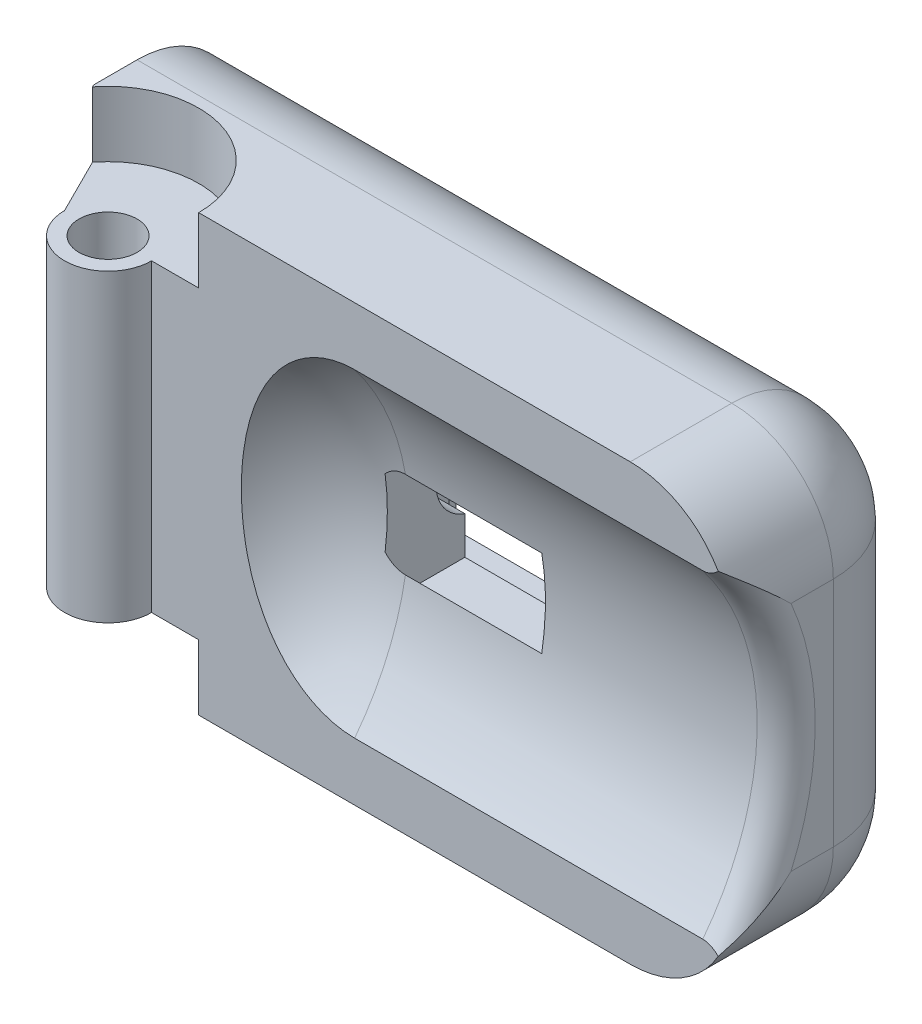
from build123d import *

# Parameters (mm, degrees)
CROQUIS1_W                 = 48
CROQUIS1_H                 = 30
SALIENTE_EXTRUIR1_DEPTH    = 14
CORTAR_EXTRUIR1_DEPTH      = 36
REDONDEO1_R                = 2
REDONDEO2_R                = 7
CROQUIS3_W                 = 21.5
CROQUIS3_H                 = 18
CORTAR_EXTRUIR2_DEPTH      = 3
CORTAR_EXTRUIR3_REACH      = 50.842
CORTAR_EXTRUIR3_END_RADIUS = 18
CROQUIS5_R                 = 1
CROQUIS6_W                 = 10.8
CROQUIS6_H                 = 10.8
CORTAR_EXTRUIR4_DEPTH      = 7.5
CROQUIS7_W                 = 17
CROQUIS7_H                 = 16
CORTAR_EXTRUIR5_DEPTH      = 2
CROQUIS9_R                 = 3
SALIENTE_EXTRUIR2_DEPTH    = 30
CROQUIS10_R                = 6.25
CORTAR_EXTRUIR7_DEPTH      = 4.5
CROQUIS11_R                = 2
CORTAR_EXTRUIR8_DEPTH      = 21
CORTAR_EXTRUIR9_REACH      = 57.883
CROQUIS13_W                = 3
CROQUIS13_H                = 5
CORTAR_EXTRUIR10_DEPTH     = 3
REDONDEO3_R                = 10
CROQUIS14_R                = 2.948637221
CORTAR_EXTRUIR15_DEPTH     = 21


with BuildPart() as part:
    # Croquis1 → Saliente-Extruir1 (new body)
    with BuildSketch(Plane.XY):
        with Locations((-19.976765257, 0.987352556)):
            Rectangle(CROQUIS1_W, CROQUIS1_H)
    extrude(amount=SALIENTE_EXTRUIR1_DEPTH)

    # Croquis2 → Cortar-Extruir1 (cut)
    with BuildSketch(Plane(origin=(4.023234743, 0, 0), x_dir=(0, 0, -1), z_dir=(1, 0, 0))):
        with BuildLine():
            ThreePointArc((-14, -10.012647444), (-10.247806849, 0.987352556), (-14, 11.987352556))
            Line((-14, 11.987352556), (-14, -10.012647444))
        make_face()
    extrude(amount=-CORTAR_EXTRUIR1_DEPTH, mode=Mode.SUBTRACT)

    # Redondeo1
    redondeo1_edges = [part.edges().sort_by_distance(p)[0] for p in [
        (4.023234743, 0.987352556, 10.247806849),
    ]]
    fillet(redondeo1_edges, radius=REDONDEO1_R)

    # Redondeo2
    # the kernel refuses this fillet: 7 mm, written as the material it takes off along each edge
    with BuildSketch(Plane(origin=(-2.976765257, -7.012647444, 7), x_dir=(0, -1, 0), z_dir=(1, 0, 0))) as redondeo2_piece_1_section:
        Polygon((0, 0), (REDONDEO2_R * 1.02, 0), (REDONDEO2_R * 1.02, REDONDEO2_R * 1.02), (0, REDONDEO2_R * 1.02), align=None)
    redondeo2_piece_1 = extrude(amount=REDONDEO2_R * 1.02, mode=Mode.PRIVATE)
    redondeo2_piece_1 = redondeo2_piece_1 - Plane(origin=(-2.976765257, -7.012647444, 7), x_dir=(0, 0.7071067811865475, 0.7071067811865475), z_dir=(1, 0, 0)) * Sphere(REDONDEO2_R, mode=Mode.PRIVATE)
    add(redondeo2_piece_1, mode=Mode.SUBTRACT)
    with BuildSketch(Plane(origin=(-2.976765257, 8.987352556, 7), x_dir=(0, 0, -1), z_dir=(1, 0, 0))) as redondeo2_piece_2_section:
        Polygon((0, 0), (REDONDEO2_R * 1.02, 0), (REDONDEO2_R * 1.02, REDONDEO2_R * 1.02), (0, REDONDEO2_R * 1.02), align=None)
    redondeo2_piece_2 = extrude(amount=REDONDEO2_R * 1.02, mode=Mode.PRIVATE)
    redondeo2_piece_2 = redondeo2_piece_2 - Plane(origin=(-2.976765257, 8.987352556, 7), x_dir=(0, -0.7071067811865475, 0.7071067811865475), z_dir=(1, 0, 0)) * Sphere(REDONDEO2_R, mode=Mode.PRIVATE)
    add(redondeo2_piece_2, mode=Mode.SUBTRACT)
    with BuildSketch(Plane(origin=(-2.976765257, -14.012647444, 0), x_dir=(0, 0, 1), z_dir=(-1, 0, 0))) as redondeo2_piece_3:
        with BuildLine():
            CenterArc((REDONDEO2_R, REDONDEO2_R), REDONDEO2_R, 180, 90)
            Line((0, REDONDEO2_R), (-REDONDEO2_R * 0.02, REDONDEO2_R))
            Line((-REDONDEO2_R * 0.02, REDONDEO2_R), (-REDONDEO2_R * 0.02, -REDONDEO2_R * 0.02))
            Line((-REDONDEO2_R * 0.02, -REDONDEO2_R * 0.02), (REDONDEO2_R, -REDONDEO2_R * 0.02))
            Line((REDONDEO2_R, -REDONDEO2_R * 0.02), (REDONDEO2_R, 0))
        make_face()
    extrude(amount=58.5, mode=Mode.SUBTRACT)
    with BuildSketch(Plane(origin=(4.023234743, 8.987352556, 0), x_dir=(0, 0, 1), z_dir=(0, -1, 0))) as redondeo2_piece_4:
        with BuildLine():
            CenterArc((REDONDEO2_R, REDONDEO2_R), REDONDEO2_R, 180, 90)
            Line((0, REDONDEO2_R), (-REDONDEO2_R * 0.02, REDONDEO2_R))
            Line((-REDONDEO2_R * 0.02, REDONDEO2_R), (-REDONDEO2_R * 0.02, -REDONDEO2_R * 0.02))
            Line((-REDONDEO2_R * 0.02, -REDONDEO2_R * 0.02), (REDONDEO2_R, -REDONDEO2_R * 0.02))
            Line((REDONDEO2_R, -REDONDEO2_R * 0.02), (REDONDEO2_R, 0))
        make_face()
    extrude(amount=16, mode=Mode.SUBTRACT)
    with BuildSketch(Plane(origin=(-61.476765257, 15.987352556, 0), x_dir=(0, -1, 0), z_dir=(1, 0, 0))) as redondeo2_piece_5:
        with BuildLine():
            CenterArc((REDONDEO2_R, -REDONDEO2_R), REDONDEO2_R, 90, 90)
            Line((0, -REDONDEO2_R), (-REDONDEO2_R * 0.02, -REDONDEO2_R))
            Line((-REDONDEO2_R * 0.02, -REDONDEO2_R), (-REDONDEO2_R * 0.02, REDONDEO2_R * 0.02))
            Line((-REDONDEO2_R * 0.02, REDONDEO2_R * 0.02), (REDONDEO2_R, REDONDEO2_R * 0.02))
            Line((REDONDEO2_R, REDONDEO2_R * 0.02), (REDONDEO2_R, 0))
        make_face()
    extrude(amount=58.5, mode=Mode.SUBTRACT)
    with BuildSketch(Plane(origin=(4.023234743, 15.987352556, 7), x_dir=(0, -1, 0), z_dir=(0, 0, 1))) as redondeo2_piece_6:
        with BuildLine():
            CenterArc((REDONDEO2_R, -REDONDEO2_R), REDONDEO2_R, 90, 90)
            Line((0, -REDONDEO2_R), (-REDONDEO2_R * 0.02, -REDONDEO2_R))
            Line((-REDONDEO2_R * 0.02, -REDONDEO2_R), (-REDONDEO2_R * 0.02, REDONDEO2_R * 0.02))
            Line((-REDONDEO2_R * 0.02, REDONDEO2_R * 0.02), (REDONDEO2_R, REDONDEO2_R * 0.02))
            Line((REDONDEO2_R, REDONDEO2_R * 0.02), (REDONDEO2_R, 0))
        make_face()
    extrude(amount=24.5, mode=Mode.SUBTRACT)
    with BuildSketch(Plane(origin=(4.023234743, -14.012647444, 7), x_dir=(0, 1, 0), z_dir=(0, 0, 1))) as redondeo2_piece_7:
        with BuildLine():
            CenterArc((REDONDEO2_R, REDONDEO2_R), REDONDEO2_R, 180, 90)
            Line((0, REDONDEO2_R), (-REDONDEO2_R * 0.02, REDONDEO2_R))
            Line((-REDONDEO2_R * 0.02, REDONDEO2_R), (-REDONDEO2_R * 0.02, -REDONDEO2_R * 0.02))
            Line((-REDONDEO2_R * 0.02, -REDONDEO2_R * 0.02), (REDONDEO2_R, -REDONDEO2_R * 0.02))
            Line((REDONDEO2_R, -REDONDEO2_R * 0.02), (REDONDEO2_R, 0))
        make_face()
    extrude(amount=24.5, mode=Mode.SUBTRACT)

    # Croquis3 → Cortar-Extruir2 (cut)
    with BuildSketch(Plane(origin=(0, 0, 0), x_dir=(-1, 0, 0), z_dir=(0, 0, -1))):
        with Locations((18.226765257, 0.987352556)):
            Rectangle(CROQUIS3_W, CROQUIS3_H)
    extrude(amount=-CORTAR_EXTRUIR2_DEPTH, mode=Mode.SUBTRACT)

    # Cortar-Extruir3: up to this cylinder (the profile starts outside it)
    cortar_extruir3_end = Plane(origin=(-17.976765, 0.987352556, 28.247806849), z_dir=(1, 0, 0)) * Cylinder(CORTAR_EXTRUIR3_END_RADIUS, 138.684, mode=Mode.PRIVATE)
    # Croquis5 → Cortar-Extruir3 (cut, up to the surface)
    with BuildSketch(Plane(origin=(0, 0, 0), x_dir=(-1, 0, 0), z_dir=(0, 0, -1)), mode=Mode.PRIVATE) as cortar_extruir3_sk1:
        with Locations((17.976765257, 0.987352556)):
            Circle(CROQUIS5_R)
    cortar_extruir3_tool1 = extrude(cortar_extruir3_sk1.sketch, amount=-CORTAR_EXTRUIR3_REACH, mode=Mode.PRIVATE) - cortar_extruir3_end
    add(cortar_extruir3_tool1.solids().sort_by_distance((-17.976765, 0.987353, 0))[0], mode=Mode.SUBTRACT)

    # Croquis6 → Cortar-Extruir4 (cut)
    with BuildSketch(Plane(origin=(0, 0, 3), x_dir=(-1, 0, 0), z_dir=(0, 0, -1))):
        with Locations((17.976765257, 0.987352556)):
            Rectangle(CROQUIS6_W, CROQUIS6_H)
    extrude(amount=-CORTAR_EXTRUIR4_DEPTH, mode=Mode.SUBTRACT)

    # Croquis7 → Cortar-Extruir5 (cut)
    with BuildSketch(Plane(origin=(0, 0, 3), x_dir=(-1, 0, 0), z_dir=(0, 0, -1))):
        with Locations((17.976765257, 0.987352556)):
            Rectangle(CROQUIS7_W, CROQUIS7_H)
    extrude(amount=-CORTAR_EXTRUIR5_DEPTH, mode=Mode.SUBTRACT)

    # Croquis9 → Saliente-Extruir2 (add)
    with BuildSketch(Plane.XZ.offset(14.012647444)):
        with Locations((-38.976765257, 14)):
            Circle(CROQUIS9_R)
    extrude(amount=-SALIENTE_EXTRUIR2_DEPTH)

    # Croquis10 → Cortar-Extruir7 (cut)
    with BuildSketch(Plane(origin=(0, 15.987352556, 0), x_dir=(1, 0, 0), z_dir=(0, 1, 0))):
        with Locations((-38.976765257, -14)):
            Circle(CROQUIS10_R)
    cortar_extruir7 = extrude(amount=-CORTAR_EXTRUIR7_DEPTH, mode=Mode.SUBTRACT)

    # Simetría1: Cortar-Extruir7 across plane
    add(cortar_extruir7.mirror(Plane.ZX.offset(0.987352556)), mode=Mode.SUBTRACT)

    # Croquis11 → Cortar-Extruir8 (cut)
    with BuildSketch(Plane(origin=(0, 11.487352556, 0), x_dir=(-1, 0, 0), z_dir=(0, 1, 0))):
        with Locations(Location((38.976765257, 14, 0), (0, 0, 90))):
            Circle(CROQUIS11_R)
    extrude(amount=-CORTAR_EXTRUIR8_DEPTH, mode=Mode.SUBTRACT)

    # Cortar-Extruir9: up to this face of the body (flat: up to its plane)
    cortar_extruir9_end = Plane(part.part.faces().sort_by_distance((-19.613737998, -14.012647444, 10.301702011))[0])
    # Croquis12 → Cortar-Extruir9 (cut, up to the picked face)
    with BuildSketch(Plane(origin=(0, 15.987352556, 0), x_dir=(1, 0, 0), z_dir=(0, 1, 0)), mode=Mode.PRIVATE) as cortar_extruir9_sk1:
        Polygon((-43.976765257, -10), (-43.976765257, -14), (-41.976765257, -14), align=None)
    cortar_extruir9_tool1 = split(extrude(cortar_extruir9_sk1.sketch, amount=-CORTAR_EXTRUIR9_REACH, mode=Mode.PRIVATE), bisect_by=cortar_extruir9_end, keep=Keep.BOTH, mode=Mode.PRIVATE)
    add(cortar_extruir9_tool1.solids().sort_by(Axis((-43.310099, 15.987353, 12.666667), (0, -1, 0)))[0], mode=Mode.SUBTRACT)

    # Croquis13 → Cortar-Extruir10 (cut)
    with BuildSketch(Plane(origin=(0, 0, 0), x_dir=(-1, 0, 0), z_dir=(0, 0, -1))):
        with Locations((30.476765257, 0.987352556)):
            Rectangle(CROQUIS13_W, CROQUIS13_H)
    extrude(amount=-CORTAR_EXTRUIR10_DEPTH, mode=Mode.SUBTRACT)

    # Redondeo3
    # the kernel refuses this fillet: 10 mm, written as the material it adds along each edge
    with BuildSketch(Plane(origin=(-31.976765257, 0.987352556, 28.247806849), x_dir=(0, -0.8888591986408035, 0.45818045025036674), z_dir=(0, 0.45818045025036674, 0.8888591986408035))) as redondeo3_piece_1_section:
        with BuildLine():
            CenterArc((18 - REDONDEO3_R, REDONDEO3_R), REDONDEO3_R, 270, 90)
            Line((18 - REDONDEO3_R, 0), (18, 0))
            Line((18, 0), (18, REDONDEO3_R))
        make_face()
    redondeo3_piece_1 = revolve(axis=Axis((-31.976765257, 0.987352556, 28.247806849), (1, 0, 0)), revolution_arc=234.53951494, mode=Mode.PRIVATE)
    redondeo3_piece_1 = split(redondeo3_piece_1, bisect_by=Plane(origin=(-22.679016641, -5.92095726, 14), z_dir=(0, 0, -1)), keep=Keep.TOP, mode=Mode.PRIVATE)
    redondeo3_piece_1 = split(redondeo3_piece_1, bisect_by=Plane(origin=(-22.679016641, -5.92095726, 10.5), z_dir=(0, 0, 1)), keep=Keep.TOP, mode=Mode.PRIVATE)
    add(redondeo3_piece_1)
    with BuildSketch(Plane(origin=(-31.976765257, 0.987352556, 28.247806849), x_dir=(0, -0.8888591986408035, 0.45818045025036674), z_dir=(0, 0.45818045025036674, 0.8888591986408035))) as redondeo3_piece_2_section:
        with BuildLine():
            CenterArc((18 - REDONDEO3_R, REDONDEO3_R), REDONDEO3_R, 270, 90)
            Line((18 - REDONDEO3_R, 0), (18, 0))
            Line((18, 0), (18, REDONDEO3_R))
        make_face()
    redondeo3_piece_2 = revolve(axis=Axis((-31.976765257, 0.987352556, 28.247806849), (1, 0, 0)), revolution_arc=234.53951494, mode=Mode.PRIVATE)
    redondeo3_piece_2 = split(redondeo3_piece_2, bisect_by=Plane(origin=(-27.760529224, 0.987352545, 10.5), z_dir=(0, 0, -1)), keep=Keep.TOP, mode=Mode.PRIVATE)
    redondeo3_piece_2 = split(redondeo3_piece_2, bisect_by=Plane(origin=(-23.376765257, 0.987352545, 10.397912487), z_dir=(-1, 0, 0)), keep=Keep.TOP, mode=Mode.PRIVATE)
    add(redondeo3_piece_2)

    # Croquis14 → Cortar-Extruir15 (cut)
    with BuildSketch(Plane.ZY.offset(43.976765257)):
        with Locations(Location((4.059124212, 0.987352556, 0), (0, 0, 270))):
            Circle(CROQUIS14_R)
    extrude(amount=-CORTAR_EXTRUIR15_DEPTH, mode=Mode.SUBTRACT)


solid = part.part
